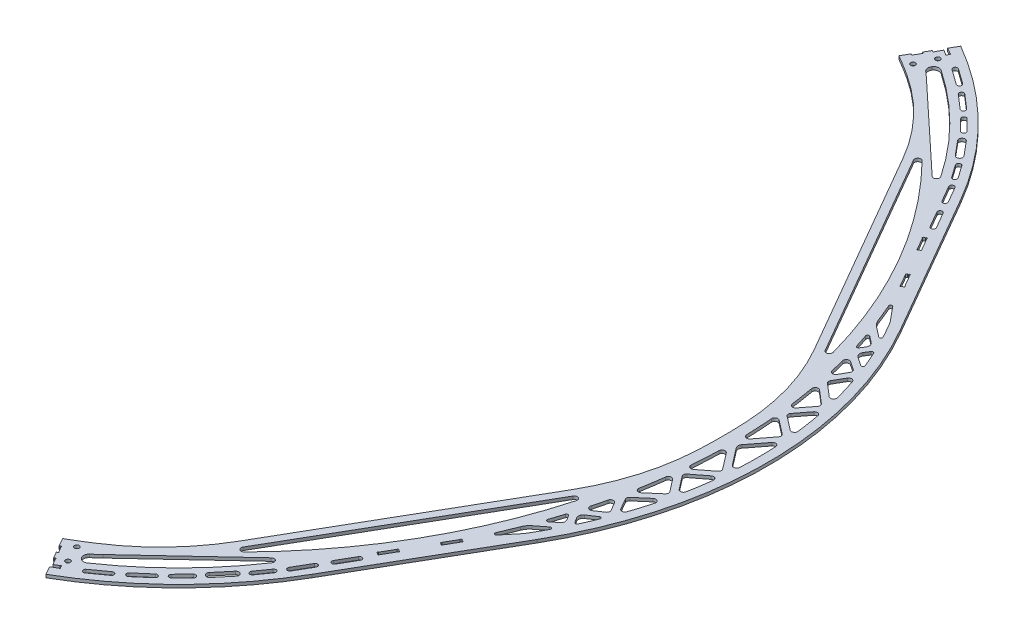
from build123d import *

# Parameters (mm, degrees)
SKETCH_1_R                       = 327.5
SKETCH_1_R_2                     = 312.5
EXTRUDE_1_DEPTH                  = 2
FILLET_1_R                       = 235
CUT_EXTRUDE_5_DEPTH              = 474.385877735
CUT_EXTRUDE_6_DEPTH              = 3
PATTERN_CIRCULAR_1_COUNT         = 5
PATTERN_CIRCULAR_1_ANGLE         = 240
PATTERN_CIRCULAR_5_COUNT         = 6
SKETCH_3_W                       = 214.60661686
SKETCH_3_H                       = 5
EXTRUDE_1_2_DEPTH                = 2
FILLET_2_R                       = 2
FILLET_3_R                       = 140
PATTERN_CIRCULAR_3_COUNT         = 6
FILLET_2_OF_PATTERN_CIRCULAR_3_R = 2
FILLET_3_OF_PATTERN_CIRCULAR_3_R = 140
CUT_EXTRUDE_8_DEPTH              = 10
FILLET_4_R                       = 3.5
FILLET_5_R                       = 2
FILLET_4_OF_MIRROR_2_R           = 3.5
FILLET_5_OF_MIRROR_2_R           = 2
PATTERN_CIRCULAR_6_COUNT         = 5
PATTERN_CIRCULAR_6_ANGLE         = 240
FILLET_4_OF_PATTERN_CIRCULAR_6_R = 3.5
FILLET_5_OF_PATTERN_CIRCULAR_6_R = 2
PATTERN_CIRCULAR_7_DEPTH         = 2
FILLET_6_R                       = 150
CUT_EXTRUDE_9_DEPTH              = 10
EXTRUDE_2_DEPTH                  = 2
FILLET_7_R                       = 2
FILLET_8_R                       = 1
FILLET_9_R                       = 3
FILLET_10_R                      = 1
FILLET_11_R                      = 10
SKETCH_14_R                      = 1.55
CUT_EXTRUDE_12_DEPTH             = 474.385877877
PATTERN_CIRCULAR_8_COUNT         = 3
CUT_EXTRUDE_11_DEPTH             = 474.385877877


with BuildPart() as part:
    # 草图1 → Extrude 1 (new body)
    # profile 1 of 7: a face of its own
    with BuildSketch(Plane(origin=(0, 0, 0), x_dir=(1, 0, 0), z_dir=(0, 1, 0))):
        with BuildLine():
            Line((283.623316881, 163.75000495), (189.08221316, 327.5))
            Line((189.08221316, 327.5), (3.91e-07, 327.5))
            ThreePointArc((3.91e-07, 327.5), (163.749997694, 283.623321071), (283.623316881, 163.75000495))
        make_face()
    # profile 2 of 7: a face of its own
    with BuildSketch(Plane(origin=(0, 0, 0), x_dir=(1, 0, 0), z_dir=(0, 1, 0))):
        Circle(SKETCH_1_R)
        with Locations(Location((0, 0, 0), (0, 0, 270))):
            Circle(SKETCH_1_R_2, mode=Mode.SUBTRACT)
    # profile 3 of 7: a face of its own
    with BuildSketch(Plane(origin=(0, 0, 0), x_dir=(1, 0, 0), z_dir=(0, 1, 0))):
        with BuildLine():
            Line((378.164426319, 0), (283.623316881, 163.75000495))
            ThreePointArc((283.623316881, 163.75000495), (316.34070737, 84.763240032), (327.5, 0))
            ThreePointArc((327.5, 0), (316.340709033, -84.763233826), (283.623323306, -163.749993823))
            Line((283.623323306, -163.749993823), (378.164426319, 0))
        make_face()
    # profile 4 of 7: a face of its own
    with BuildSketch(Plane(origin=(0, 0, 0), x_dir=(1, 0, 0), z_dir=(0, 1, 0))):
        with BuildLine():
            Line((189.08221316, -327.5), (283.623323306, -163.749993823))
            ThreePointArc((283.623323306, -163.749993823), (163.750003363, -283.623317798), (6.33e-07, -327.5))
            Line((6.33e-07, -327.5), (189.08221316, -327.5))
        make_face()
    # profile 5 of 7: a face of its own
    with BuildSketch(Plane(origin=(0, 0, 0), x_dir=(1, 0, 0), z_dir=(0, 1, 0))):
        with BuildLine():
            ThreePointArc((6.33e-07, -327.5), (-163.749996617, -283.623321693), (-283.62331615, -163.750006218))
            Line((-283.62331615, -163.750006218), (-189.08221316, -327.5))
            Line((-189.08221316, -327.5), (6.33e-07, -327.5))
        make_face()
    # profile 6 of 7: a face of its own
    with BuildSketch(Plane(origin=(0, 0, 0), x_dir=(1, 0, 0), z_dir=(0, 1, 0))):
        with BuildLine():
            ThreePointArc((-283.62331615, -163.750006218), (-327.5, 2.592e-06), (-283.623313558, 163.750010707))
            Line((-283.623313558, 163.750010707), (-378.164426319, 0))
            Line((-378.164426319, 0), (-283.62331615, -163.750006218))
        make_face()
    # profile 7 of 7: a face of its own
    with BuildSketch(Plane(origin=(0, 0, 0), x_dir=(1, 0, 0), z_dir=(0, 1, 0))):
        with BuildLine():
            ThreePointArc((-283.623313558, 163.750010707), (-163.749994477, 283.623322928), (3.91e-07, 327.5))
            Line((3.91e-07, 327.5), (-189.08221316, 327.5))
            Line((-189.08221316, 327.5), (-283.623313558, 163.750010707))
        make_face()
    extrude(amount=EXTRUDE_1_DEPTH)

    # 圆角1
    fillet_1_edges = [part.edges().sort_by_distance(p)[0] for p in [
        (189.08221316, 1, -327.5),
        (378.164426319, 1, 0),
        (189.08221316, 1, 327.5),
        (-189.08221316, 1, 327.5),
        (-378.164426319, 1, 0),
        (-189.08221316, 1, -327.5),
    ]]
    fillet(fillet_1_edges, radius=FILLET_1_R)

    # 草图2 → 切除-拉伸5 (cut, through all)
    with BuildSketch(Plane(origin=(0, 2, 0), x_dir=(1, 0, 0), z_dir=(0, 1, 0))):
        with BuildLine():
            ThreePointArc((162.730125101, 291.956844598), (162.426521922, 291.723881685), (162.376571711, 291.344472162))
            ThreePointArc((162.376571711, 291.344472162), (162.609534624, 291.040868983), (162.988944147, 290.990918772))
            Line((162.988944147, 290.990918772), (165.840673326, 289.344472162))
            Line((165.840673326, 289.344472162), (163.644226717, 285.540115039))
            ThreePointArc((163.644226717, 285.540115039), (163.290673326, 284.927742603), (163.903045762, 284.574189212))
            Line((163.903045762, 284.574189212), (164.496954238, 284.231295993))
            ThreePointArc((164.496954238, 284.231295993), (165.109326674, 283.877742603), (165.462880065, 284.490115039))
            Line((165.462880065, 284.490115039), (167.659326674, 288.294472162))
            Line((167.659326674, 288.294472162), (170.511055853, 286.648025553))
            ThreePointArc((170.511055853, 286.648025553), (170.744018767, 286.344422373), (171.123428289, 286.294472162))
            ThreePointArc((171.123428289, 286.294472162), (171.427031468, 286.527435075), (171.47698168, 286.906844598))
            Line((171.47698168, 286.906844598), (171.819874899, 287.500753074))
            ThreePointArc((171.819874899, 287.500753074), (172.123478078, 287.733715988), (172.173428289, 288.11312551))
            ThreePointArc((172.173428289, 288.11312551), (171.940465376, 288.416728689), (171.561055853, 288.466678901))
            Line((171.561055853, 288.466678901), (164.038944147, 292.809572119))
            ThreePointArc((164.038944147, 292.809572119), (163.426571711, 293.16312551), (163.07301832, 292.550753074))
            Line((163.07301832, 292.550753074), (162.730125101, 291.956844598))
        make_face()
        with BuildLine():
            Line((162.096954238, 280.074374055), (161.503045762, 280.417267274))
            ThreePointArc((161.503045762, 280.417267274), (160.890673326, 280.770820665), (160.537119935, 280.158448229))
            Line((160.537119935, 280.158448229), (158.644226717, 276.879861001))
            ThreePointArc((158.644226717, 276.879861001), (158.290673326, 276.267488565), (158.903045762, 275.913935174))
            Line((158.903045762, 275.913935174), (159.496954238, 275.571041956))
            ThreePointArc((159.496954238, 275.571041956), (160.109326674, 275.217488565), (160.462880065, 275.829861001))
            Line((160.462880065, 275.829861001), (162.355773283, 279.108448229))
            ThreePointArc((162.355773283, 279.108448229), (162.709326674, 279.720820665), (162.096954238, 280.074374055))
        make_face()
    cut_extrude_5 = extrude(amount=-CUT_EXTRUDE_5_DEPTH, mode=Mode.SUBTRACT)

    # 草图2<4> → 切除-拉伸6 (cut)
    with BuildSketch(Plane(origin=(0, 2, 0), x_dir=(1, 0, 0), z_dir=(0, 1, 0))):
        Polygon((10.657106781, 320.55), (9.95, 320.55), (9.95, 319.842893219), (9.95, 319.157106781), (9.95, 318.45), (10.657106781, 318.45), (19.342893219, 318.45), (20.05, 318.45), (20.05, 319.157106781), (20.05, 319.842893219), (20.05, 320.55), (19.342893219, 320.55), align=None)
        with BuildLine():
            ThreePointArc((20.05, 320.55), (19.696446609, 320.696446609), (19.342893219, 320.55))
            Line((19.342893219, 320.55), (20.05, 320.55))
        make_face()
        with BuildLine():
            ThreePointArc((20.05, 319.842893219), (20.196446609, 320.196446609), (20.05, 320.55))
            Line((20.05, 320.55), (20.05, 319.842893219))
        make_face()
        with BuildLine():
            Line((20.05, 319.157106781), (20.05, 318.45))
            ThreePointArc((20.05, 318.45), (20.196446609, 318.803553391), (20.05, 319.157106781))
        make_face()
        with BuildLine():
            Line((20.05, 318.45), (19.342893219, 318.45))
            ThreePointArc((19.342893219, 318.45), (19.696446609, 318.303553391), (20.05, 318.45))
        make_face()
        with BuildLine():
            ThreePointArc((9.95, 319.157106781), (9.803553391, 318.803553391), (9.95, 318.45))
            Line((9.95, 318.45), (9.95, 319.157106781))
        make_face()
        with BuildLine():
            Line((10.657106781, 318.45), (9.95, 318.45))
            ThreePointArc((9.95, 318.45), (10.303553391, 318.303553391), (10.657106781, 318.45))
        make_face()
        with BuildLine():
            Line((9.95, 319.842893219), (9.95, 320.55))
            ThreePointArc((9.95, 320.55), (9.803553391, 320.196446609), (9.95, 319.842893219))
        make_face()
        with BuildLine():
            ThreePointArc((10.657106781, 320.55), (10.303553391, 320.696446609), (9.95, 320.55))
            Line((9.95, 320.55), (10.657106781, 320.55))
        make_face()
        Polygon((-19.342893219, 320.55), (-20.05, 320.55), (-20.05, 319.842893219), (-20.05, 319.157106781), (-20.05, 318.45), (-19.342893219, 318.45), (-10.657106781, 318.45), (-9.95, 318.45), (-9.95, 319.157106781), (-9.95, 319.842893219), (-9.95, 320.55), (-10.657106781, 320.55), align=None)
        with BuildLine():
            Line((-20.05, 319.842893219), (-20.05, 320.55))
            ThreePointArc((-20.05, 320.55), (-20.196446609, 320.196446609), (-20.05, 319.842893219))
        make_face()
        with BuildLine():
            ThreePointArc((-19.342893219, 320.55), (-19.696446609, 320.696446609), (-20.05, 320.55))
            Line((-20.05, 320.55), (-19.342893219, 320.55))
        make_face()
        with BuildLine():
            Line((-20.05, 318.45), (-20.05, 319.157106781))
            ThreePointArc((-20.05, 319.157106781), (-20.196446609, 318.803553391), (-20.05, 318.45))
        make_face()
        with BuildLine():
            Line((-19.342893219, 318.45), (-20.05, 318.45))
            ThreePointArc((-20.05, 318.45), (-19.696446609, 318.303553391), (-19.342893219, 318.45))
        make_face()
        with BuildLine():
            ThreePointArc((-9.95, 319.842893219), (-9.803553391, 320.196446609), (-9.95, 320.55))
            Line((-9.95, 320.55), (-9.95, 319.842893219))
        make_face()
        with BuildLine():
            ThreePointArc((-9.95, 320.55), (-10.303553391, 320.696446609), (-10.657106781, 320.55))
            Line((-10.657106781, 320.55), (-9.95, 320.55))
        make_face()
        with BuildLine():
            ThreePointArc((-9.95, 318.45), (-9.803553391, 318.803553391), (-9.95, 319.157106781))
            Line((-9.95, 319.157106781), (-9.95, 318.45))
        make_face()
        with BuildLine():
            Line((-9.95, 318.45), (-10.657106781, 318.45))
            ThreePointArc((-10.657106781, 318.45), (-10.303553391, 318.303553391), (-9.95, 318.45))
        make_face()
    cut_extrude_6 = extrude(amount=-CUT_EXTRUDE_6_DEPTH, mode=Mode.SUBTRACT)

    # 阵列(圆周)1: 切除-拉伸5 ×5 about axis
    pattern_circular_1_axis = Axis((0, 0, 0), (0, 1, 0))
    for i in range(1, PATTERN_CIRCULAR_1_COUNT):
        add(cut_extrude_5.rotate(pattern_circular_1_axis, i * PATTERN_CIRCULAR_1_ANGLE / (PATTERN_CIRCULAR_1_COUNT - 1)), mode=Mode.SUBTRACT)

    # 阵列(圆周)5: 切除-拉伸6 ×6 about axis
    pattern_circular_5_axis = Axis((0, 0, 0), (0, 1, 0))
    for i in range(1, PATTERN_CIRCULAR_5_COUNT):
        add(cut_extrude_6.rotate(pattern_circular_5_axis, i * 360 / PATTERN_CIRCULAR_5_COUNT), mode=Mode.SUBTRACT)

    # 草图3 → Extrude 1 2 (add)
    with BuildSketch(Plane(origin=(0, 2, 0), x_dir=(1, 0, 0), z_dir=(0, 1, 0))):
        with Locations((0, 296)):
            Rectangle(SKETCH_3_W, SKETCH_3_H)
    extrude_1_2 = extrude(amount=-EXTRUDE_1_2_DEPTH)

    # 圆角2
    fillet_2_edges = [part.edges().sort_by_distance(p)[0] for p in [
        (-92.487837038, 1, -298.5),
        (92.487837038, 1, -298.5),
    ]]
    fillet(fillet_2_edges, radius=FILLET_2_R)

    # 圆角3
    fillet_3_edges = [part.edges().sort_by_distance(p)[0] for p in [
        (-107.30330843, 1, -293.5),
        (107.30330843, 1, -293.5),
    ]]
    fillet(fillet_3_edges, radius=FILLET_3_R)

    # 阵列(圆周)3: Extrude 1 2 ×6 about axis
    pattern_circular_3_axis = Axis((0, 0, 0), (0, 1, 0))
    for i in range(1, PATTERN_CIRCULAR_3_COUNT):
        add(extrude_1_2.rotate(pattern_circular_3_axis, i * 360 / PATTERN_CIRCULAR_3_COUNT))

    # 圆角2 of 阵列(圆周)3
    fillet_2_of_pattern_circular_3_edges = [part.edges().sort_by_distance(p)[0] for p in [
        (-304.752501549, 1, -69.153183584),
        (-212.264664511, 1, -229.346816416),
        (-212.264664511, 1, 229.346816416),
        (-304.752501549, 1, 69.153183584),
        (92.487837038, 1, 298.5),
        (-92.487837038, 1, 298.5),
        (304.752501549, 1, 69.153183584),
        (212.264664511, 1, 229.346816416),
        (212.264664511, 1, -229.346816416),
        (304.752501549, 1, -69.153183584),
    ]]
    fillet(fillet_2_of_pattern_circular_3_edges, radius=FILLET_2_OF_PATTERN_CIRCULAR_3_R)

    # 圆角3 of 阵列(圆周)3
    fillet_3_of_pattern_circular_3_edges = [part.edges().sort_by_distance(p)[0] for p in [
        (-307.830110226, 1, -53.82260899),
        (-200.526801796, 1, -239.67739101),
        (-200.526801796, 1, 239.67739101),
        (-307.830110226, 1, 53.82260899),
        (107.30330843, 1, 293.5),
        (-107.30330843, 1, 293.5),
        (307.830110226, 1, 53.82260899),
        (200.526801796, 1, 239.67739101),
        (200.526801796, 1, -239.67739101),
        (307.830110226, 1, -53.82260899),
    ]]
    fillet(fillet_3_of_pattern_circular_3_edges, radius=FILLET_3_OF_PATTERN_CIRCULAR_3_R)

    # 草图7 → 切除-拉伸8 (cut)
    with BuildSketch(Plane.XZ):
        with BuildLine():
            Line((175.029626383, 278.218674096), (171.086610158, 272.197762343))
            ThreePointArc((171.086610158, 272.197762343), (172.755924627, 271.141366276), (174.418716459, 270.074732896))
            Line((174.418716459, 270.074732896), (245.66253954, 203.5))
            ThreePointArc((245.66253954, 203.5), (214.731447639, 245.004901543), (175.029626383, 278.218674096))
        make_face()
        with BuildLine():
            Line((264.76819272, 186.40803798), (258.76819272, 196.800342825))
            ThreePointArc((258.76819272, 196.800342825), (256.719154615, 197.349380931), (256.170116509, 195.300342825))
            Line((256.170116509, 195.300342825), (262.170116509, 184.90803798))
            ThreePointArc((262.170116509, 184.90803798), (264.219154615, 184.358999874), (264.76819272, 186.40803798))
        make_face()
        with BuildLine():
            ThreePointArc((190.839721204, 273.168590348), (192.933431066, 273.509734029), (192.592287386, 275.603443891))
            Line((192.592287386, 275.603443891), (182.852873213, 282.61370862))
            ThreePointArc((182.852873213, 282.61370862), (180.75916335, 282.27256494), (181.10030703, 280.178855077))
            Line((181.10030703, 280.178855077), (190.839721204, 273.168590348))
        make_face()
        with BuildLine():
            ThreePointArc((206.108151691, 260.461860366), (208.223669166, 260.618659005), (208.066870527, 262.73417648))
            Line((208.066870527, 262.73417648), (198.977606072, 270.569051825))
            ThreePointArc((198.977606072, 270.569051825), (196.862088597, 270.412253186), (197.018887236, 268.296735711))
            Line((197.018887236, 268.296735711), (206.108151691, 260.461860366))
        make_face()
        with BuildLine():
            ThreePointArc((218.524851069, 248.271396128), (220.646117994, 248.256341871), (220.661172251, 250.377608797))
            Line((220.661172251, 250.377608797), (213.640463353, 257.498679403))
            ThreePointArc((213.640463353, 257.498679403), (211.519196428, 257.51373366), (211.504142171, 255.392466734))
            Line((211.504142171, 255.392466734), (218.524851069, 248.271396128))
        make_face()
        with BuildLine():
            ThreePointArc((230.453086683, 232.965532251), (233.270529754, 232.716505069), (233.519556936, 235.533948141))
            Line((233.519556936, 235.533948141), (225.814309265, 244.733358901))
            ThreePointArc((225.814309265, 244.733358901), (222.996866194, 244.982386083), (222.747839012, 242.164943011))
            Line((222.747839012, 242.164943011), (230.453086683, 232.965532251))
        make_face()
        with BuildLine():
            ThreePointArc((241.512590207, 219.562279899), (243.603584351, 219.204867688), (243.960996561, 221.295861833))
            Line((243.960996561, 221.295861833), (238.182390115, 229.457216348))
            ThreePointArc((238.182390115, 229.457216348), (236.09139597, 229.814628559), (235.73398376, 227.723634415))
            Line((235.73398376, 227.723634415), (241.512590207, 219.562279899))
        make_face()
        with BuildLine():
            ThreePointArc((248.26819272, 214.986876305), (246.219154615, 215.53591441), (245.670116509, 213.486876305))
            Line((245.670116509, 213.486876305), (251.670116509, 203.094571459))
            ThreePointArc((251.670116509, 203.094571459), (253.719154615, 202.545533354), (254.26819272, 204.594571459))
            Line((254.26819272, 204.594571459), (248.26819272, 214.986876305))
        make_face()
    cut_extrude_8 = extrude(amount=-CUT_EXTRUDE_8_DEPTH, mode=Mode.SUBTRACT)

    # 圆角4
    fillet_4_edges = [part.edges().sort_by_distance(p)[0] for p in [
        (171.086610158, 1, 272.197762343),
        (175.029626383, 1, 278.218674096),
    ]]
    fillet(fillet_4_edges, radius=FILLET_4_R)

    # 圆角5
    fillet_5_edges = [part.edges().sort_by_distance(p)[0] for p in [
        (245.66253954, 1, 203.5),
    ]]
    fillet(fillet_5_edges, radius=FILLET_5_R)

    # 镜向2: 切除-拉伸8 across plane
    add(cut_extrude_8.mirror(Plane(origin=(0, 0, 0), x_dir=(0.5000000000000141, 0, 0.8660254037844304), z_dir=(0.8660254037844306, 0, -0.5000000000000141))), mode=Mode.SUBTRACT)

    # 圆角4 of 镜向2
    fillet_4_of_mirror_2_edges = [part.edges().sort_by_distance(p)[0] for p in [
        (150.186871963, 1, 284.264231816),
        (153.429626383, 1, 290.68943991),
    ]]
    fillet(fillet_4_of_mirror_2_edges, radius=FILLET_4_OF_MIRROR_2_R)

    # 圆角5 of 镜向2
    fillet_5_of_mirror_2_edges = [part.edges().sort_by_distance(p)[0] for p in [
        (53.4048999, 1, 314.5),
    ]]
    fillet(fillet_5_of_mirror_2_edges, radius=FILLET_5_OF_MIRROR_2_R)

    # 阵列(圆周)6: 切除-拉伸8 ×5 about axis
    pattern_circular_6_axis = Axis((0, 0, 0), (0, -1, 0))
    for i in range(1, PATTERN_CIRCULAR_6_COUNT):
        add(cut_extrude_8.rotate(pattern_circular_6_axis, i * PATTERN_CIRCULAR_6_ANGLE / (PATTERN_CIRCULAR_6_COUNT - 1)), mode=Mode.SUBTRACT)

    # 圆角4 of 阵列(圆周)6
    fillet_4_of_pattern_circular_6_edges = [part.edges().sort_by_distance(p)[0] for p in [
        (-150.186871963, 1, 284.264231816),
        (-153.429626383, 1, 290.68943991),
        (-321.273482121, 1, 12.066469473),
        (-328.459252766, 1, 12.470765814),
        (-171.086610158, 1, -272.197762343),
        (-175.029626383, 1, -278.218674096),
        (150.186871963, 1, -284.264231816),
        (153.429626383, 1, -290.68943991),
    ]]
    fillet(fillet_4_of_pattern_circular_6_edges, radius=FILLET_4_OF_PATTERN_CIRCULAR_6_R)

    # 圆角5 of 阵列(圆周)6
    fillet_5_of_pattern_circular_6_edges = [part.edges().sort_by_distance(p)[0] for p in [
        (-53.4048999, 1, 314.5),
        (-299.06743944, 1, 111),
        (-245.66253954, 1, -203.5),
        (53.4048999, 1, -314.5),
    ]]
    fillet(fillet_5_of_pattern_circular_6_edges, radius=FILLET_5_OF_PATTERN_CIRCULAR_6_R)

    # 阵列(圆周)7: read off the stored shape, not the designer's step
    # 阵列(圆周)7 outline → 阵列(圆周)7 (cut)
    with BuildSketch(Plane(origin=(0, 0, 0), x_dir=(1, 0, 0), z_dir=(0, 1, 0))):
        with BuildLine():
            ThreePointArc((173.029525119, 275.164557014), (172.534006986, 272.519352771), (174.062595071, 270.304389526))
            ThreePointArc((174.062595071, 270.304389526), (174.240693602, 270.189619884), (174.418716459, 270.074732896))
            Line((174.418716459, 270.074732896), (234.541476653, 213.892224325))
            ThreePointArc((234.541476653, 213.892224325), (237.204395136, 213.8314224), (237.566105281, 216.470361106))
            ThreePointArc((237.566105281, 216.470361106), (210.644220788, 249.215653228), (177.988920442, 276.246623985))
            ThreePointArc((177.988920442, 276.246623985), (175.337698979, 276.78161955), (173.096760841, 275.2672247))
            Line((173.096760841, 275.2672247), (173.029525119, 275.164557014))
        make_face()
        with BuildLine():
            ThreePointArc((-151.784734036, 287.430242865), (-149.74167903, 285.678509452), (-147.059170549, 285.894823943))
            ThreePointArc((-147.059170549, 285.894823943), (-146.870727857, 285.991676975), (-146.682221378, 286.088405797))
            Line((-146.682221378, 286.088405797), (-67.965361611, 310.064989185))
            ThreePointArc((-67.965361611, 310.064989185), (-66.581246358, 312.340743277), (-68.685779244, 313.973462804))
            ThreePointArc((-68.685779244, 313.973462804), (-110.504976322, 307.031072977), (-150.242133859, 292.266238687))
            ThreePointArc((-150.242133859, 292.266238687), (-152.031064342, 290.237711332), (-151.840028998, 287.539804551))
            Line((-151.840028998, 287.539804551), (-151.784734036, 287.430242865))
        make_face()
        with BuildLine():
            ThreePointArc((-324.814259155, 12.265685851), (-322.275686016, 13.159156681), (-321.12176562, 15.590434417))
            ThreePointArc((-321.12176562, 15.590434417), (-321.111421459, 15.80205709), (-321.100937838, 16.013672901))
            Line((-321.100937838, 16.013672901), (-302.506838264, 96.17276486))
            ThreePointArc((-302.506838264, 96.17276486), (-303.785641494, 98.509320877), (-306.251884525, 97.503101698))
            ThreePointArc((-306.251884525, 97.503101698), (-321.14919711, 57.815419749), (-328.231054301, 16.019614702))
            ThreePointArc((-328.231054301, 16.019614702), (-327.368763321, 13.456091782), (-324.93678984, 12.272579852))
            Line((-324.93678984, 12.272579852), (-324.814259155, 12.265685851))
        make_face()
        with BuildLine():
            ThreePointArc((-173.029525119, -275.164557014), (-172.534006986, -272.519352771), (-174.062595071, -270.304389526))
            ThreePointArc((-174.062595071, -270.304389526), (-174.240693602, -270.189619884), (-174.418716459, -270.074732896))
            Line((-174.418716459, -270.074732896), (-234.541476653, -213.892224325))
            ThreePointArc((-234.541476653, -213.892224325), (-237.204395136, -213.8314224), (-237.566105281, -216.470361106))
            ThreePointArc((-237.566105281, -216.470361106), (-210.644220788, -249.215653228), (-177.988920442, -276.246623985))
            ThreePointArc((-177.988920442, -276.246623985), (-175.337698979, -276.78161955), (-173.096760841, -275.2672247))
            Line((-173.096760841, -275.2672247), (-173.029525119, -275.164557014))
        make_face()
        with BuildLine():
            Line((-307.720116509, 106.013123695), (-301.720116509, 116.405428541))
            ThreePointArc((-301.720116509, 116.405428541), (-302.269154615, 118.454466646), (-304.31819272, 117.905428541))
            Line((-304.31819272, 117.905428541), (-310.31819272, 107.513123695))
            ThreePointArc((-310.31819272, 107.513123695), (-309.769154615, 105.464085589), (-307.720116509, 106.013123695))
        make_face()
        with BuildLine():
            Line((-297.220116509, 124.199657175), (-291.220116509, 134.59196202))
            ThreePointArc((-291.220116509, 134.59196202), (-291.769154614, 136.641000126), (-293.81819272, 136.09196202))
            Line((-293.81819272, 136.09196202), (-299.81819272, 125.699657175))
            ThreePointArc((-299.81819272, 125.699657175), (-299.269154615, 123.650619069), (-297.220116509, 124.199657175))
        make_face()
        with BuildLine():
            Line((-62.05, 319.5), (-50.05, 319.5))
            ThreePointArc((-50.05, 319.5), (-48.55, 321), (-50.05, 322.5))
            Line((-50.05, 322.5), (-62.05, 322.5))
            ThreePointArc((-62.05, 322.5), (-63.55, 321), (-62.05, 319.5))
        make_face()
        with BuildLine():
            Line((-41.05, 319.5), (-29.05, 319.5))
            ThreePointArc((-29.05, 319.5), (-27.55, 321), (-29.05, 322.5))
            Line((-29.05, 322.5), (-41.05, 322.5))
            ThreePointArc((-41.05, 322.5), (-42.55, 321), (-41.05, 319.5))
        make_face()
        with BuildLine():
            Line((-245.670116509, -213.486876305), (-251.670116509, -203.094571459))
            ThreePointArc((-251.670116509, -203.094571459), (-253.719154614, -202.545533354), (-254.26819272, -204.594571459))
            Line((-254.26819272, -204.594571459), (-248.26819272, -214.986876305))
            ThreePointArc((-248.26819272, -214.986876305), (-246.219154614, -215.535914411), (-245.670116509, -213.486876305))
        make_face()
        with BuildLine():
            Line((-256.170116509, -195.300342825), (-262.170116509, -184.90803798))
            ThreePointArc((-262.170116509, -184.90803798), (-264.219154615, -184.358999874), (-264.76819272, -186.40803798))
            Line((-264.76819272, -186.40803798), (-258.76819272, -196.800342825))
            ThreePointArc((-258.76819272, -196.800342825), (-256.719154614, -197.349380931), (-256.170116509, -195.300342825))
        make_face()
        with BuildLine():
            Line((245.670116509, 213.486876305), (251.670116509, 203.094571459))
            ThreePointArc((251.670116509, 203.094571459), (253.719154614, 202.545533354), (254.26819272, 204.594571459))
            Line((254.26819272, 204.594571459), (248.26819272, 214.986876305))
            ThreePointArc((248.26819272, 214.986876305), (246.219154614, 215.535914411), (245.670116509, 213.486876305))
        make_face()
        with BuildLine():
            Line((256.170116509, 195.300342825), (262.170116509, 184.90803798))
            ThreePointArc((262.170116509, 184.90803798), (264.219154615, 184.358999874), (264.76819272, 186.40803798))
            Line((264.76819272, 186.40803798), (258.76819272, 196.800342825))
            ThreePointArc((258.76819272, 196.800342825), (256.719154614, 197.349380931), (256.170116509, 195.300342825))
        make_face()
        with BuildLine():
            Line((235.73398376, 227.723634415), (241.512590207, 219.562279899))
            ThreePointArc((241.512590207, 219.562279899), (243.603584351, 219.204867688), (243.960996561, 221.295861833))
            Line((243.960996561, 221.295861833), (238.182390115, 229.457216348))
            ThreePointArc((238.182390115, 229.457216348), (236.091395971, 229.814628559), (235.73398376, 227.723634415))
        make_face()
        with BuildLine():
            Line((-79.347460565, 318.013435679), (-69.390217002, 318.937178402))
            ThreePointArc((-69.390217002, 318.937178402), (-68.035191876, 320.569326345), (-69.667339819, 321.924351471))
            Line((-69.667339819, 321.924351471), (-79.624583382, 321.000608748))
            ThreePointArc((-79.624583382, 321.000608748), (-80.979608508, 319.368460805), (-79.347460565, 318.013435679))
        make_face()
        with BuildLine():
            Line((-315.081444325, 90.289801264), (-310.902807208, 99.374898503))
            ThreePointArc((-310.902807208, 99.374898503), (-311.638776226, 101.364458657), (-313.62833638, 100.628489638))
            Line((-313.62833638, 100.628489638), (-317.806973497, 91.543392399))
            ThreePointArc((-317.806973497, 91.543392399), (-317.071004478, 89.553832246), (-315.081444325, 90.289801264))
        make_face()
        with BuildLine():
            Line((-235.73398376, -227.723634415), (-241.512590207, -219.562279899))
            ThreePointArc((-241.512590207, -219.562279899), (-243.603584351, -219.204867688), (-243.960996561, -221.295861833))
            Line((-243.960996561, -221.295861833), (-238.182390115, -229.457216349))
            ThreePointArc((-238.182390115, -229.457216349), (-236.091395971, -229.814628559), (-235.73398376, -227.723634415))
        make_face()
        with BuildLine():
            Line((211.504142171, 255.392466734), (218.524851069, 248.271396128))
            ThreePointArc((218.524851069, 248.271396128), (220.646117995, 248.256341871), (220.661172251, 250.377608797))
            Line((220.661172251, 250.377608797), (213.640463353, 257.498679403))
            ThreePointArc((213.640463353, 257.498679403), (211.519196427, 257.51373366), (211.504142171, 255.392466734))
        make_face()
        with BuildLine():
            Line((-115.424293041, 310.864193493), (-105.746910545, 313.383770447))
            ThreePointArc((-105.746910545, 313.383770447), (-104.673239714, 315.213314365), (-106.502783632, 316.286985196))
            Line((-106.502783632, 316.286985196), (-116.180166127, 313.767408242))
            ThreePointArc((-116.180166127, 313.767408242), (-117.253836959, 311.937864324), (-115.424293041, 310.864193493))
        make_face()
        with BuildLine():
            Line((-326.928435213, 55.471726759), (-324.271761614, 65.11237432))
            ThreePointArc((-324.271761614, 65.11237432), (-325.319357708, 66.956972494), (-327.163955882, 65.909376399))
            Line((-327.163955882, 65.909376399), (-329.820629481, 56.268728839))
            ThreePointArc((-329.820629481, 56.268728839), (-328.773033387, 54.424130665), (-326.928435213, 55.471726759))
        make_face()
        with BuildLine():
            Line((-211.504142171, -255.392466734), (-218.524851069, -248.271396128))
            ThreePointArc((-218.524851069, -248.271396128), (-220.646117995, -248.256341871), (-220.661172251, -250.377608797))
            Line((-220.661172251, -250.377608797), (-213.640463353, -257.498679403))
            ThreePointArc((-213.640463353, -257.498679403), (-211.519196427, -257.51373366), (-211.504142171, -255.392466734))
        make_face()
        with BuildLine():
            Line((222.747839012, 242.164943011), (230.453086683, 232.965532251))
            ThreePointArc((230.453086683, 232.965532251), (233.270529755, 232.716505069), (233.519556936, 235.533948141))
            Line((233.519556936, 235.533948141), (225.814309265, 244.733358901))
            ThreePointArc((225.814309265, 244.733358901), (222.996866193, 244.982386083), (222.747839012, 242.164943011))
        make_face()
        with BuildLine():
            Line((-98.347073047, 313.987758728), (-86.527525794, 316.060993573))
            ThreePointArc((-86.527525794, 316.060993573), (-84.903140393, 318.376457256), (-87.218604076, 320.000842658))
            Line((-87.218604076, 320.000842658), (-99.038151329, 317.927607812))
            ThreePointArc((-99.038151329, 317.927607812), (-100.662536731, 315.612144129), (-98.347073047, 313.987758728))
        make_face()
        with BuildLine():
            Line((-321.094912059, 71.822815717), (-316.980612477, 83.095461322))
            ThreePointArc((-316.980612477, 83.095461322), (-318.173670147, 85.659952187), (-320.738161012, 84.466894517))
            Line((-320.738161012, 84.466894517), (-324.852460595, 73.194248911))
            ThreePointArc((-324.852460595, 73.194248911), (-323.659402924, 70.629758047), (-321.094912059, 71.822815717))
        make_face()
        with BuildLine():
            Line((-222.747839012, -242.164943011), (-230.453086683, -232.965532251))
            ThreePointArc((-230.453086683, -232.965532251), (-233.270529755, -232.716505069), (-233.519556936, -235.533948141))
            Line((-233.519556936, -235.533948141), (-225.814309265, -244.733358901))
            ThreePointArc((-225.814309265, -244.733358901), (-222.996866193, -244.982386083), (-222.747839012, -242.164943011))
        make_face()
        with BuildLine():
            Line((197.018887236, 268.296735711), (206.108151691, 260.461860366))
            ThreePointArc((206.108151691, 260.461860366), (208.223669166, 260.618659005), (208.066870527, 262.73417648))
            Line((208.066870527, 262.73417648), (198.977606072, 270.569051825))
            ThreePointArc((198.977606072, 270.569051825), (196.862088597, 270.412253186), (197.018887236, 268.296735711))
        make_face()
        with BuildLine():
            Line((-133.84234526, 304.771729227), (-122.512511949, 308.725825474))
            ThreePointArc((-122.512511949, 308.725825474), (-121.590544816, 310.636316669), (-123.501036011, 311.558283802))
            Line((-123.501036011, 311.558283802), (-134.830869322, 307.604187555))
            ThreePointArc((-134.830869322, 307.604187555), (-135.752836455, 305.69369636), (-133.84234526, 304.771729227))
        make_face()
        with BuildLine():
            Line((-330.861232496, 36.474993516), (-328.620663639, 48.263965108))
            ThreePointArc((-328.620663639, 48.263965108), (-329.814213982, 50.017657664), (-331.567906538, 48.824107322))
            Line((-331.567906538, 48.824107322), (-333.808475394, 37.03513573))
            ThreePointArc((-333.808475394, 37.03513573), (-332.614925052, 35.281443174), (-330.861232496, 36.474993516))
        make_face()
        with BuildLine():
            Line((-197.018887236, -268.296735711), (-206.108151691, -260.461860366))
            ThreePointArc((-206.108151691, -260.461860366), (-208.223669166, -260.618659005), (-208.066870527, -262.73417648))
            Line((-208.066870527, -262.73417648), (-198.977606072, -270.569051825))
            ThreePointArc((-198.977606072, -270.569051825), (-196.862088597, -270.412253186), (-197.018887236, -268.296735711))
        make_face()
        with BuildLine():
            Line((181.10030703, 280.178855077), (190.839721204, 273.168590348))
            ThreePointArc((190.839721204, 273.168590348), (192.933431066, 273.509734029), (192.592287386, 275.603443891))
            Line((192.592287386, 275.603443891), (182.852873213, 282.61370862))
            ThreePointArc((182.852873213, 282.61370862), (180.75916335, 282.27256494), (181.10030703, 280.178855077))
        make_face()
        with BuildLine():
            Line((-152.091852585, 296.92689406), (-141.151078156, 301.856341787))
            ThreePointArc((-141.151078156, 301.856341787), (-140.399662318, 303.840119557), (-142.383440088, 304.591535395))
            Line((-142.383440088, 304.591535395), (-153.324214516, 299.662087667))
            ThreePointArc((-153.324214516, 299.662087667), (-154.075630354, 297.678309898), (-152.091852585, 296.92689406))
        make_face()
        with BuildLine():
            Line((-333.192159615, 16.748038983), (-331.990799359, 28.687751439))
            ThreePointArc((-331.990799359, 28.687751439), (-333.333093384, 30.330385528), (-334.975727473, 28.988091503))
            Line((-334.975727473, 28.988091503), (-336.177087729, 17.048379047))
            ThreePointArc((-336.177087729, 17.048379047), (-334.834793704, 15.405744958), (-333.192159615, 16.748038983))
        make_face()
        with BuildLine():
            Line((-181.10030703, -280.178855077), (-190.839721204, -273.168590348))
            ThreePointArc((-190.839721204, -273.168590348), (-192.933431066, -273.509734029), (-192.592287386, -275.603443891))
            Line((-192.592287386, -275.603443891), (-182.852873213, -282.61370862))
            ThreePointArc((-182.852873213, -282.61370862), (-180.75916335, -282.27256494), (-181.10030703, -280.178855077))
        make_face()
    extrude(amount=PATTERN_CIRCULAR_7_DEPTH, mode=Mode.SUBTRACT)

    # 圆角6
    fillet_6_edges = [part.edges().sort_by_distance(p)[0] for p in [
        (146.682221378, 1, -286.088405797),
        (174.418716459, 1, -270.074732896),
        (146.682221378, 1, 286.088405797),
        (174.418716459, 1, 270.074732896),
        (-146.682221378, 1, 286.088405797),
        (-174.418716459, 1, 270.074732896),
        (-321.100937838, 1, 16.013672901),
        (-321.100937838, 1, -16.013672901),
        (-174.418716459, 1, -270.074732896),
        (-146.682221378, 1, -286.088405797),
    ]]
    fillet(fillet_6_edges, radius=FILLET_6_R)

    # 草图8 → 切除-拉伸9 (cut)
    with BuildSketch(Plane.XZ):
        with BuildLine():
            Line((302.817848262, 118.413871392), (290.108207292, 133.85618425))
            ThreePointArc((290.108207292, 133.85618425), (310.26164492, 76.275564186), (319.103420339, 15.914054407))
            ThreePointArc((319.103420339, 15.914054407), (319.5, 0), (319.103420339, -15.914054407))
            ThreePointArc((319.103420339, -15.914054407), (310.26164492, -76.275564186), (290.108207292, -133.85618425))
            Line((290.108207292, -133.85618425), (302.817848262, -118.413871392))
            ThreePointArc((302.817848262, -118.413871392), (303.983444234, -116.462671877), (305.129617267, -114.5))
            ThreePointArc((305.129617267, -114.5), (335.8097998, 0), (305.129617267, 114.5))
            ThreePointArc((305.129617267, 114.5), (303.983444234, 116.462671877), (302.817848262, 118.413871392))
        make_face()
    extrude(amount=-CUT_EXTRUDE_9_DEPTH, mode=Mode.SUBTRACT)

    # 草图9 → Extrude 2 (add)
    with BuildSketch(Plane.XZ):
        Polygon((321.083327329, -1.221914306), (337.740007188, 20.361413023), (320.570335235, 33.611906084), (333.118886318, 49.872018411), (315.462628768, 65.029511263), (324.19651492, 80.209096569), (309.41246768, 90.163513286), (315.68331411, 100.057257179), (301.341871148, 111.171888446), (294.890265776, 116.171888446), (292.439977327, 113.010229622), (298.8915827, 108.010229622), (310.356561231, 99.12486089), (303.951020445, 89.018604783), (318.870465958, 78.9730215), (310.343235994, 64.152606806), (327.632581366, 49.310099658), (314.959851967, 32.889080038), (332.129523919, 19.638586977), (317.916672671, 1.221914306), align=None)
    extrude_2 = extrude(amount=-EXTRUDE_2_DEPTH)

    # 镜向3: Extrude 2 across plane
    add(extrude_2.mirror(Plane.XY))

    # 圆角7
    fillet_7_edges = [part.edges().sort_by_distance(p)[0] for p in [
        (335.175101459, 1, 17.037869533),
        (334.679619564, 1, 22.723231296),
        (330.927856052, 1, 47.032933803),
        (329.622174594, 1, 52.873865366),
        (322.427888379, 1, 77.135205177),
        (307.538957314, 1, 86.602769784),
        (312.283111555, 1, 67.52413078),
        (313.543727082, 1, 61.405058484),
        (317.451921469, 1, 36.118244087),
        (318.039703778, 1, 30.512240505),
        (319.48344842, 1, 3.252104843),
        (315.462628768, 1, 65.029511263),
        (320.570335235, 1, 33.611906084),
        (332.129523919, 1, 19.638586977),
        (327.632581366, 1, 49.310099658),
        (318.870465958, 1, 78.9730215),
        (322.427888379, 1, -77.135205177),
        (329.622174594, 1, -52.873865366),
        (330.927856051, 1, -47.032933803),
        (334.679619564, 1, -22.723231296),
        (320.570335235, 1, -33.611906084),
        (315.462628768, 1, -65.029511263),
        (335.175101459, 1, -17.037869533),
        (307.538957314, 1, -86.602769784),
        (312.283111555, 1, -67.52413078),
        (318.870465958, 1, -78.9730215),
        (313.543727082, 1, -61.405058484),
        (317.451921469, 1, -36.118244087),
        (327.632581366, 1, -49.310099658),
        (318.039703778, 1, -30.512240505),
        (319.48344842, 1, -3.252104843),
        (332.129523919, 1, -19.638586977),
    ]]
    fillet(fillet_7_edges, radius=FILLET_7_R)

    # 圆角8
    fillet_8_edges = [part.edges().sort_by_distance(p)[0] for p in [
        (320.30531825, 1, 82.82912291),
        (314.036270739, 1, 97.458656579),
        (310.985476872, 1, 103.698085287),
        (301.373196066, 1, 106.086977019),
        (305.92682827, 1, 92.135909093),
        (310.985476872, 1, -103.698085287),
        (314.036270739, 1, -97.458656579),
        (320.30531825, 1, -82.82912291),
        (301.373196066, 1, -106.086977019),
        (305.92682827, 1, -92.135909093),
    ]]
    fillet(fillet_8_edges, radius=FILLET_8_R)

    # 圆角9
    fillet_9_edges = [part.edges().sort_by_distance(p)[0] for p in [
        (309.41246768, 1, 90.163513286),
        (310.356561231, 1, 99.12486089),
        (322.02632537, 1, 0),
        (309.41246768, 1, -90.163513286),
        (310.356561231, 1, -99.12486089),
    ]]
    fillet(fillet_9_edges, radius=FILLET_9_R)

    # 圆角10
    fillet_10_edges = [part.edges().sort_by_distance(p)[0] for p in [
        (290.108207292, 1, -133.85618425),
        (290.108207292, 1, 133.85618425),
    ]]
    fillet(fillet_10_edges, radius=FILLET_10_R)

    # 圆角11
    fillet_11_edges = [part.edges().sort_by_distance(p)[0] for p in [
        (302.817848262, 1, 118.413871392),
        (302.817848262, 1, -118.413871392),
        (298.79463277, 1, 113.146000494),
        (298.79463277, 1, -113.146000494),
    ]]
    fillet(fillet_11_edges, radius=FILLET_11_R)

    # 草图14 → 切除-拉伸12 (cut, through all)
    with BuildSketch(Plane(origin=(0, 2, 0), x_dir=(1, 0, 0), z_dir=(0, 1, 0))):
        with Locations(Location((170.612177826, 281.508960385, 0), (0, 0, 270))):
            Circle(SKETCH_14_R)
        with Locations(Location((165.47820323, 270.61665554, 0), (0, 0, 270))):
            Circle(SKETCH_14_R)
        with Locations(Location((151.62179677, 278.61665554, 0), (0, 0, 90))):
            Circle(SKETCH_14_R)
        with Locations(Location((158.487822174, 288.508960385, 0), (0, 0, 90))):
            Circle(SKETCH_14_R)
    cut_extrude_12 = extrude(amount=-CUT_EXTRUDE_12_DEPTH, mode=Mode.SUBTRACT)

    # 阵列(圆周)8: 切除-拉伸12 ×3 about axis
    pattern_circular_8_axis = Axis((0, 0, 0), (0, 1, 0))
    for i in range(1, PATTERN_CIRCULAR_8_COUNT):
        add(cut_extrude_12.rotate(pattern_circular_8_axis, i * 360 / PATTERN_CIRCULAR_8_COUNT), mode=Mode.SUBTRACT)

    # 草图13 → 切除-拉伸11 (cut, through all)
    with BuildSketch(Plane.XZ):
        with BuildLine():
            Line((175, -303.108891325), (0, 0))
            Line((0, 0), (-350, 0))
            ThreePointArc((-350, 0), (-175, -303.108891325), (175, -303.108891325))
        make_face()
        with BuildLine():
            Line((-350, 0), (0, 0))
            Line((0, 0), (175, 303.108891325))
            ThreePointArc((175, 303.108891325), (-175, 303.108891325), (-350, 0))
        make_face()
    extrude(amount=-CUT_EXTRUDE_11_DEPTH, mode=Mode.SUBTRACT)


solid = part.part
